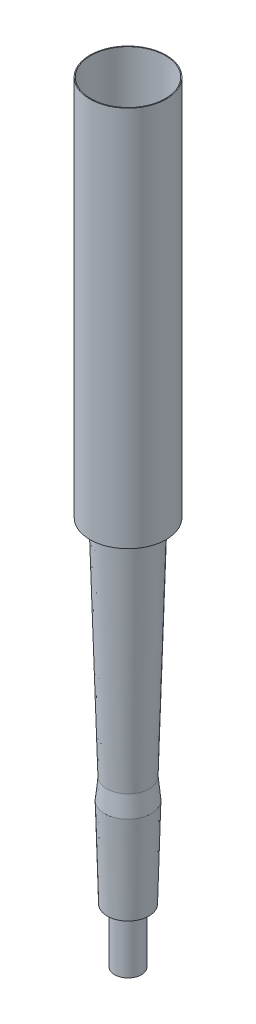
from build123d import *

# Parameters (mm, degrees)
SKETCH1_R               = 1.67
SKETCH1_R_2             = 1.5
BOSS_EXTRUDE1_DEPTH     = 6.8
SHELL3_T                = -0.1
CUT_EXTRUDE2_DEPTH      = 10080
CUT_EXTRUDE2_DEPTH_BACK = 97.274641521
SKETCH7_R               = 1.5


# Read off the part's stored shape, not the designer's step: Shell1
with BuildPart() as part:
    # Sketch1 → Boss-Extrude1 (new body)
    with BuildSketch(Plane(origin=(0, 0, 0), x_dir=(1, 0, 0), z_dir=(0, 1, 0))):
        with Locations(Location((0, 0, 0), (0, 0, 270))):
            Circle(SKETCH1_R)
        with Locations(Location((0, 0, 0), (0, 0, 270))):
            Circle(SKETCH1_R_2, mode=Mode.SUBTRACT)
    extrude(amount=BOSS_EXTRUDE1_DEPTH)

    # Sketch4 → Revolve3 (revolve)
    with BuildSketch(Plane.XY):
        Polygon((0, 6.8), (2.6, 6.8), (2.9, 18), (0, 18), align=None)
    revolve(axis=Axis((0, 6.8, 0), (0, 1, 0)))

    # Shell1 outline → Shell1 (revolve, cut)
    with BuildSketch(Plane.XY):
        Polygon((0, 18), (0, 6.9), (2.502642704, 6.9), (2.799964133, 18), align=None)
    revolve(axis=Axis((0, 0, 0), (0, 1, 0)), mode=Mode.SUBTRACT)


with BuildPart() as body_2:
    # Sketch5 → Revolve5 (revolve)
    with BuildSketch(Plane.XY, mode=Mode.PRIVATE) as revolve5_sk:
        Polygon((-2.65, 20.5), (0, 20.5), (0, 48.5), (0, 96.04), (-4.75, 96.04), (-4.75, 48.5), (-3.45, 48.5), align=None)
    revolve(revolve5_sk.sketch.rotate(Axis((0, 0, 0), (0, 1, 0)), 270), axis=Axis((0, 0, 0), (0, 1, 0)))

    # Shell3
    shell3_openings = [body_2.faces().sort_by_distance(p)[0] for p in [
        (0, 96.04, 0),
    ]]
    offset(amount=SHELL3_T, openings=shell3_openings, kind=Kind.INTERSECTION)

    # Sketch6 → Revolve6 (revolve)
    with BuildSketch(Plane.XY, mode=Mode.PRIVATE) as revolve6_sk:
        Polygon((0, 18.104766722), (0, 20.566368387), (2.65, 20.566368387), (2.9, 18), align=None)
    revolve(revolve6_sk.sketch.rotate(Axis((0, 18.104766722, 0), (0, 1, 0)), 90), axis=Axis((0, 18.104766722, 0), (0, 1, 0)))


with BuildPart() as cut_extrude2_tool:
    # Sketch7 → Cut-Extrude2 (new, two sides: drawn at the far end of the back side and taken through both)
    with BuildSketch(Plane(origin=(0, 0, 0), x_dir=(1, 0, 0), z_dir=(0, 1, 0)).offset(-CUT_EXTRUDE2_DEPTH_BACK)):
        with Locations(Location((0, 0, 0), (0, 0, 270))):
            Circle(SKETCH7_R)
    extrude(amount=CUT_EXTRUDE2_DEPTH + CUT_EXTRUDE2_DEPTH_BACK)


with BuildPart() as part_1:
    add(part.part)

    # Cut-Extrude2: cut by cut_extrude2_tool
    add(cut_extrude2_tool.part, mode=Mode.SUBTRACT)


with BuildPart() as body_2_1:
    add(body_2.part)

    # Cut-Extrude2: cut by cut_extrude2_tool
    add(cut_extrude2_tool.part, mode=Mode.SUBTRACT)


solid = Compound([part_1.part, body_2_1.part])
